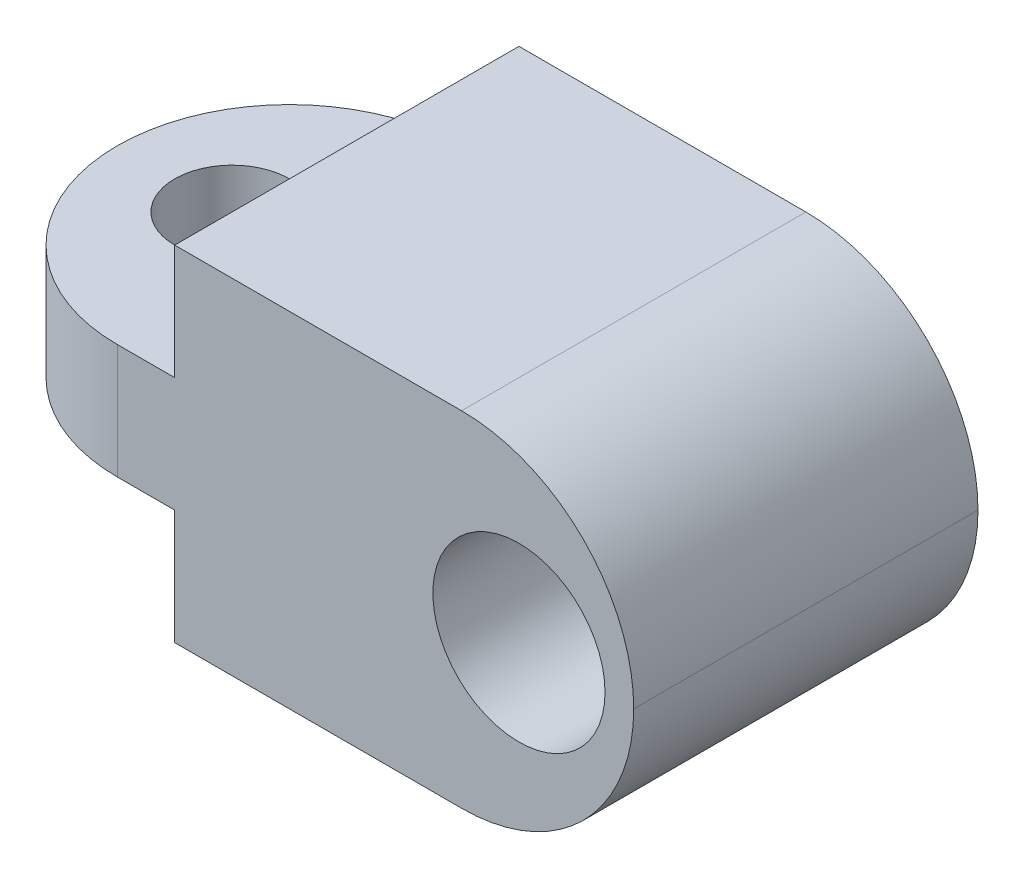
from build123d import *

# Parameters (mm, degrees)
CROQUIS4_W                 = 120
CROQUIS4_H                 = 60
SALIENTE_EXTRUIR3_DEPTH    = 60
REDONDEO1_R                = 30
CROQUIS5_W                 = 40
CROQUIS5_H                 = 20
CORTAR_EXTRUIR1_DEPTH      = 60
CORTAR_EXTRUIR2_DEPTH      = 10
CORTAR_EXTRUIR2_DEPTH_BACK = 10
CROQUIS6_R                 = 10
REDONDEO2_R                = 30
CROQUIS8_R                 = 15
CORTAR_EXTRUIR3_DEPTH      = 60


with BuildPart() as part:
    # Croquis4 → Saliente-Extruir3 (new body)
    with BuildSketch(Plane.XY):
        Rectangle(CROQUIS4_W, CROQUIS4_H)
    extrude(amount=SALIENTE_EXTRUIR3_DEPTH)

    # Redondeo1
    redondeo1_edges = [part.edges().sort_by_distance(p)[0] for p in [
        (60, -30, 30),
        (60, 30, 30),
    ]]
    fillet(redondeo1_edges, radius=REDONDEO1_R - 0.0001)  # a hair under: the kernel refuses the full size

    # Croquis5 → Cortar-Extruir1 (cut)
    with BuildSketch(Plane.XY):
        with Locations((-40, 20)):
            Rectangle(CROQUIS5_W, CROQUIS5_H)
        with Locations((-40, -20)):
            Rectangle(CROQUIS5_W, CROQUIS5_H)
    extrude(amount=CORTAR_EXTRUIR1_DEPTH, mode=Mode.SUBTRACT)

    # Croquis6 → Cortar-Extruir2 (cut, two sides: drawn at the far end of the back side and taken through both)
    with BuildSketch(Plane(origin=(0, 0, 0), x_dir=(1, 0, 0), z_dir=(0, 1, 0)).offset(-CORTAR_EXTRUIR2_DEPTH_BACK)):
        with Locations(Location((-40, -30, 0), (0, 0, 270))):
            Circle(CROQUIS6_R)
    extrude(amount=CORTAR_EXTRUIR2_DEPTH + CORTAR_EXTRUIR2_DEPTH_BACK, mode=Mode.SUBTRACT)

    # Redondeo2
    redondeo2_edges = [part.edges().sort_by_distance(p)[0] for p in [
        (-60, 0, 60),
        (-60, 0, 0),
    ]]
    fillet(redondeo2_edges, radius=REDONDEO2_R - 0.0001)  # a hair under: the kernel refuses the full size

    # Croquis8 → Cortar-Extruir3 (cut)
    with BuildSketch(Plane.XY):
        with Locations((40, 0)):
            Circle(CROQUIS8_R)
    extrude(amount=CORTAR_EXTRUIR3_DEPTH, mode=Mode.SUBTRACT)


solid = part.part
